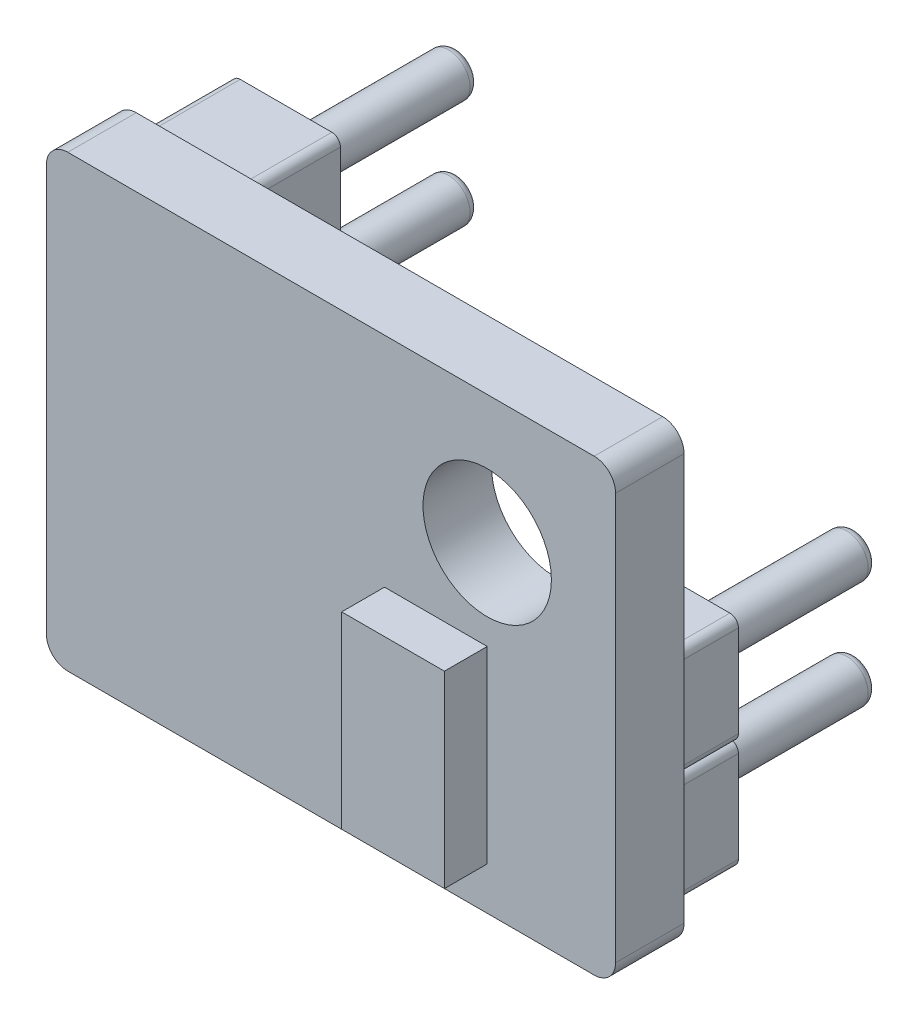
from build123d import *

# Parameters (mm, degrees)
SKETCH1_W           = 13.3
SKETCH1_H           = 10.5
BOSS_EXTRUDE1_DEPTH = 1.6
SKETCH2_R           = 1.5
CUT_EXTRUDE1_DEPTH  = 1.6
SKETCH3_W           = 2.4
SKETCH3_H           = 4.4
BOSS_EXTRUDE2_DEPTH = 1
FILLET1_R           = 0.5
SKETCH4_W           = 2.54
SKETCH4_H           = 2.54
BOSS_EXTRUDE3_DEPTH = 2
SKETCH5_R           = 0.5
BOSS_EXTRUDE4_DEPTH = 4
FILLET2_R           = 0.2
LPATTERN1_START     = -2
LPATTERN1_DEPTH     = 2
SKETCH6_W           = 2.54
SKETCH6_H           = 2.54
BOSS_EXTRUDE5_DEPTH = 2
SKETCH7_R           = 0.5
BOSS_EXTRUDE6_DEPTH = 4
FILLET3_R           = 0.2
LPATTERN2_START     = -2
LPATTERN2_DEPTH     = 2


# Read off the part's stored shape, not the designer's step: LPattern1, LPattern2
with BuildPart() as part:
    # Sketch1 → Boss-Extrude1 (new body)
    with BuildSketch(Plane.XY):
        Rectangle(SKETCH1_W, SKETCH1_H)
    extrude(amount=BOSS_EXTRUDE1_DEPTH)

    # Sketch2 → Cut-Extrude1 (cut)
    with BuildSketch(Plane.XY.offset(1.6)):
        with Locations((3.65, 2.25)):
            Circle(SKETCH2_R)
    extrude(amount=-CUT_EXTRUDE1_DEPTH, mode=Mode.SUBTRACT)

    # Sketch3 → Boss-Extrude2 (add)
    with BuildSketch(Plane.XY.offset(1.6)):
        with Locations((2.45, -2.05)):
            Rectangle(SKETCH3_W, SKETCH3_H)
    extrude(amount=BOSS_EXTRUDE2_DEPTH)

    # Fillet1
    fillet1_edges = [part.edges().sort_by_distance(p)[0] for p in [
        (-6.65, 5.25, 0.8),
        (6.65, 5.25, 0.8),
        (6.65, -5.25, 0.8),
        (-6.65, -5.25, 0.8),
    ]]
    fillet(fillet1_edges, radius=FILLET1_R)

    # Sketch4 → Boss-Extrude3 (add)
    with BuildSketch(Plane(origin=(0, 0, 0), x_dir=(-1, 0, 0), z_dir=(0, 0, -1))):
        with Locations((4.65, -3.75)):
            Rectangle(SKETCH4_W, SKETCH4_H)
    extrude(amount=BOSS_EXTRUDE3_DEPTH)

    # Sketch5 → Boss-Extrude4 (add)
    with BuildSketch(Plane(origin=(0, 0, -2), x_dir=(-1, 0, 0), z_dir=(0, 0, -1))):
        with Locations((4.65, -3.75)):
            Circle(SKETCH5_R)
    extrude(amount=BOSS_EXTRUDE4_DEPTH)

    # Fillet2
    fillet2_edges = [part.edges().sort_by_distance(p)[0] for p in [
        (-3.38, -2.48, -1),
        (-3.38, -5.02, -1),
        (-5.92, -5.02, -1),
        (-5.92, -2.48, -1),
        (-4.15, -3.75, -6),
    ]]
    fillet(fillet2_edges, radius=FILLET2_R)

    # LPattern1 outline → LPattern1 (add)
    with BuildSketch(Plane.XY.offset(LPATTERN1_START)):
        with BuildLine():
            Line((-3.38, -2.28), (-3.38, -0.14))
            ThreePointArc((-3.38, -0.14), (-3.438578644, 0.001421356), (-3.58, 0.06))
            ThreePointArc((-3.58, 0.06), (-3.438578644, 0.118578644), (-3.38, 0.26))
            Line((-3.38, 0.26), (-3.38, 2.4))
            ThreePointArc((-3.38, 2.4), (-3.438578644, 2.541421356), (-3.58, 2.6))
            ThreePointArc((-3.58, 2.6), (-3.438578644, 2.658578644), (-3.38, 2.8))
            Line((-3.38, 2.8), (-3.38, 4.94))
            ThreePointArc((-3.38, 4.94), (-3.438578644, 5.081421356), (-3.58, 5.14))
            Line((-3.58, 5.14), (-5.72, 5.14))
            ThreePointArc((-5.72, 5.14), (-5.861421356, 5.081421356), (-5.92, 4.94))
            Line((-5.92, 4.94), (-5.92, 2.8))
            ThreePointArc((-5.92, 2.8), (-5.861421356, 2.658578644), (-5.72, 2.6))
            ThreePointArc((-5.72, 2.6), (-5.861421356, 2.541421356), (-5.92, 2.4))
            Line((-5.92, 2.4), (-5.92, 0.26))
            ThreePointArc((-5.92, 0.26), (-5.861421356, 0.118578644), (-5.72, 0.06))
            ThreePointArc((-5.72, 0.06), (-5.861421356, 0.001421356), (-5.92, -0.14))
            Line((-5.92, -0.14), (-5.92, -2.28))
            ThreePointArc((-5.92, -2.28), (-5.861421356, -2.421421356), (-5.72, -2.48))
            Line((-5.72, -2.48), (-3.58, -2.48))
            ThreePointArc((-3.58, -2.48), (-3.438578644, -2.421421356), (-3.38, -2.28))
        make_face()
    extrude(amount=LPATTERN1_DEPTH)

    # LPattern1 2 outline → LPattern1 2 (revolve)
    with BuildSketch(Plane(origin=(-4.65, -1.21, 0), x_dir=(1, 0, 0), z_dir=(0, -1, 0))):
        with BuildLine():
            Line((0, -2), (0, -6))
            Line((0, -6), (0.3, -6))
            ThreePointArc((0.3, -6), (0.441421356, -5.941421356), (0.5, -5.8))
            Line((0.5, -5.8), (0.5, -2))
            Line((0.5, -2), (0, -2))
        make_face()
    revolve(axis=Axis((-4.65, -1.21, 0), (0, 0, 1)))

    # LPattern1 3 outline → LPattern1 3 (revolve)
    with BuildSketch(Plane(origin=(-4.65, 1.33, 0), x_dir=(1, 0, 0), z_dir=(0, -1, 0))):
        with BuildLine():
            Line((0, -2), (0, -6))
            Line((0, -6), (0.3, -6))
            ThreePointArc((0.3, -6), (0.441421356, -5.941421356), (0.5, -5.8))
            Line((0.5, -5.8), (0.5, -2))
            Line((0.5, -2), (0, -2))
        make_face()
    revolve(axis=Axis((-4.65, 1.33, 0), (0, 0, 1)))

    # LPattern1 4 outline → LPattern1 4 (revolve)
    with BuildSketch(Plane(origin=(-4.65, 3.87, 0), x_dir=(1, 0, 0), z_dir=(0, -1, 0))):
        with BuildLine():
            Line((0, -2), (0, -6))
            Line((0, -6), (0.3, -6))
            ThreePointArc((0.3, -6), (0.441421356, -5.941421356), (0.5, -5.8))
            Line((0.5, -5.8), (0.5, -2))
            Line((0.5, -2), (0, -2))
        make_face()
    revolve(axis=Axis((-4.65, 3.87, 0), (0, 0, 1)))

    # Sketch6 → Boss-Extrude5 (add)
    with BuildSketch(Plane(origin=(0, 0, 0), x_dir=(-1, 0, 0), z_dir=(0, 0, -1))):
        with Locations((-4.65, -3.75)):
            Rectangle(SKETCH6_W, SKETCH6_H)
    extrude(amount=BOSS_EXTRUDE5_DEPTH)

    # Sketch7 → Boss-Extrude6 (add)
    with BuildSketch(Plane(origin=(0, 0, -2), x_dir=(-1, 0, 0), z_dir=(0, 0, -1))):
        with Locations((-4.65, -3.75)):
            Circle(SKETCH7_R)
    extrude(amount=BOSS_EXTRUDE6_DEPTH)

    # Fillet3
    fillet3_edges = [part.edges().sort_by_distance(p)[0] for p in [
        (3.38, -5.02, -1),
        (3.38, -2.48, -1),
        (5.92, -2.48, -1),
        (5.92, -5.02, -1),
        (5.15, -3.75, -6),
    ]]
    fillet(fillet3_edges, radius=FILLET3_R)

    # LPattern2 outline → LPattern2 (add)
    with BuildSketch(Plane.XY.offset(LPATTERN2_START)):
        with BuildLine():
            Line((3.38, -0.14), (3.38, -2.28))
            ThreePointArc((3.38, -2.28), (3.438578644, -2.421421356), (3.58, -2.48))
            Line((3.58, -2.48), (5.72, -2.48))
            ThreePointArc((5.72, -2.48), (5.861421356, -2.421421356), (5.92, -2.28))
            Line((5.92, -2.28), (5.92, -0.14))
            ThreePointArc((5.92, -0.14), (5.861421356, 0.001421356), (5.72, 0.06))
            Line((5.72, 0.06), (3.58, 0.06))
            ThreePointArc((3.58, 0.06), (3.438578644, 0.001421356), (3.38, -0.14))
        make_face()
    extrude(amount=LPATTERN2_DEPTH)

    # LPattern2 2 outline → LPattern2 2 (revolve)
    with BuildSketch(Plane(origin=(4.65, -1.21, 0), x_dir=(1, 0, 0), z_dir=(0, -1, 0))):
        with BuildLine():
            Line((0, -2), (0, -6))
            Line((0, -6), (0.3, -6))
            ThreePointArc((0.3, -6), (0.441421356, -5.941421356), (0.5, -5.8))
            Line((0.5, -5.8), (0.5, -2))
            Line((0.5, -2), (0, -2))
        make_face()
    revolve(axis=Axis((4.65, -1.21, 0), (0, 0, 1)))


solid = part.part
